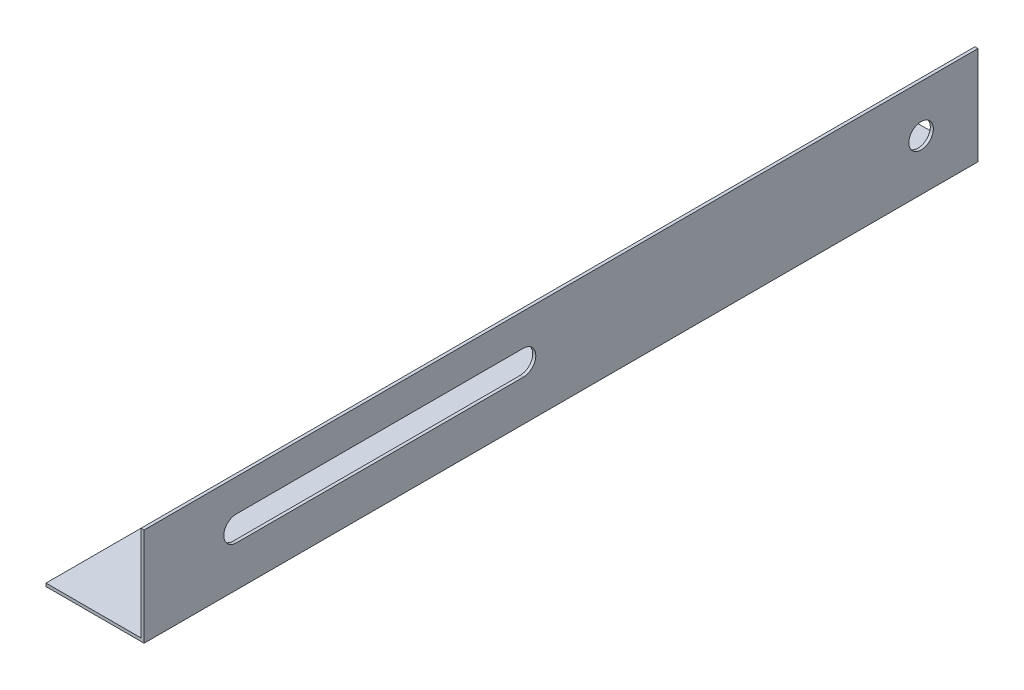
from build123d import *

# Parameters (mm, degrees)
BOSS_EXTRUDE2_DEPTH = 431.8
SKETCH8_R           = 6.35
CUT_EXTRUDE6_DEPTH  = 2.54


with BuildPart() as part:
    # Sketch3 → Boss-Extrude2 (new body)
    with BuildSketch(Plane.XY):
        Polygon((0, 0), (0, 1.5875), (49.2125, 1.5875), (49.2125, 50.8), (50.8, 50.8), (50.8, 0), align=None)
    extrude(amount=BOSS_EXTRUDE2_DEPTH)

    # Sketch8 → Cut-Extrude6 (cut)
    with BuildSketch(Plane(origin=(50.8, 0, 0), x_dir=(0, 0, -1), z_dir=(1, 0, 0))):
        with Locations((-29.464, 26.416)):
            Circle(SKETCH8_R)
        with BuildLine():
            Line((-235.458, 21.14878121), (-384.048, 21.14878121))
            ThreePointArc((-384.048, 21.14878121), (-390.525, 27.62578121), (-384.048, 34.10278121))
            Line((-384.048, 34.10278121), (-235.458, 34.10278121))
            ThreePointArc((-235.458, 34.10278121), (-228.981, 27.62578121), (-235.458, 21.14878121))
        make_face()
    extrude(amount=-CUT_EXTRUDE6_DEPTH, mode=Mode.SUBTRACT)


solid = part.part
